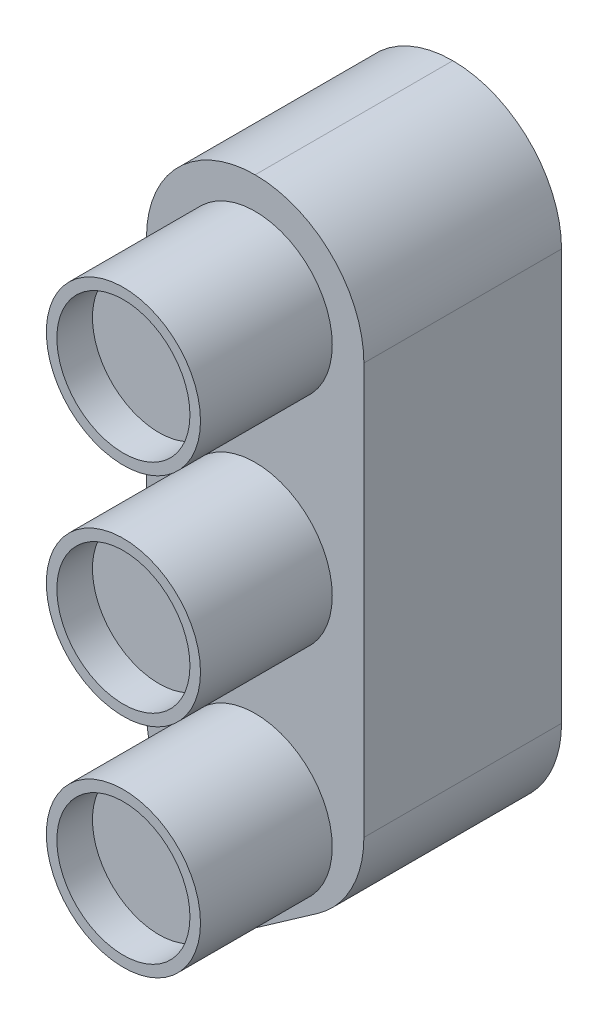
from build123d import *
from OCP.BRepFilletAPI import BRepFilletAPI_MakeChamfer

# Parameters (mm, degrees)
SKETCH1_W                       = 16.5
SKETCH1_H                       = 49.5
BOSS_EXTRUDE1_DEPTH             = 25
SKETCH2_R                       = 5.85
SKETCH2_R_2                     = 5.05
CUT_EXTRUDE1_DEPTH              = 10
FILLET5_R                       = 8.25
CHAMFER1_SIZE                   = 5.77671219
CHAMFER1_SIZE_2                 = 8.25
FILLET6_R                       = 8.25
SKETCH4_R                       = 5.1
BOSS_EXTRUDE2_DEPTH             = 7.3
SCHNITT_LINEAR_AUSTRAGEN1_DEPTH = 9


with BuildPart() as part:
    # Sketch1 → Boss-Extrude1 (new body)
    with BuildSketch(Plane.XY):
        with Locations((-90.75, 140.25)):
            Rectangle(SKETCH1_W, SKETCH1_H)
    extrude(amount=BOSS_EXTRUDE1_DEPTH)

    # Sketch2 → Cut-Extrude1 (cut)
    # profile 1 of 8: a face of its own
    with BuildSketch(Plane.XY.offset(25)):
        with BuildLine():
            ThreePointArc((-96.6, 140.25), (-90.75, 146.1), (-84.9, 140.25))
            Line((-84.9, 140.25), (-82.5, 140.25))
            Line((-82.5, 140.25), (-82.5, 165))
            Line((-82.5, 165), (-99, 165))
            Line((-99, 165), (-99, 140.25))
            Line((-99, 140.25), (-96.6, 140.25))
        make_face()
        with Locations((-90.75, 156.75)):
            Circle(SKETCH2_R, mode=Mode.SUBTRACT)
    # profile 2 of 8: a face of its own
    with BuildSketch(Plane.XY.offset(25)):
        with BuildLine():
            Line((-82.5, 140.25), (-84.9, 140.25))
            ThreePointArc((-84.9, 140.25), (-90.75, 134.4), (-96.6, 140.25))
            Line((-96.6, 140.25), (-99, 140.25))
            Line((-99, 140.25), (-99, 115.5))
            Line((-99, 115.5), (-82.5, 115.5))
            Line((-82.5, 115.5), (-82.5, 140.25))
        make_face()
        with Locations((-90.75, 123.75)):
            Circle(SKETCH2_R, mode=Mode.SUBTRACT)
    # profile 3 of 8: a face of its own
    with BuildSketch(Plane.XY.offset(25)):
        with BuildLine():
            ThreePointArc((-95.8, 140.25), (-90.75, 135.2), (-85.7, 140.25))
            Line((-85.7, 140.25), (-95.8, 140.25))
        make_face()
    # profile 4 of 8: a face of its own
    with BuildSketch(Plane.XY.offset(25)):
        with BuildLine():
            Line((-95.8, 140.25), (-85.7, 140.25))
            ThreePointArc((-85.7, 140.25), (-90.75, 145.3), (-95.8, 140.25))
        make_face()
    # profile 5 of 8: a face of its own
    with BuildSketch(Plane.XY.offset(25)):
        with BuildLine():
            ThreePointArc((-95.8, 140.25), (-90.75, 135.2), (-85.7, 140.25))
            Line((-85.7, 140.25), (-95.8, 140.25))
        make_face()
    # profile 6 of 8: a face of its own
    with BuildSketch(Plane.XY.offset(25)):
        with BuildLine():
            Line((-95.8, 140.25), (-85.7, 140.25))
            ThreePointArc((-85.7, 140.25), (-90.75, 145.3), (-95.8, 140.25))
        make_face()
    # profile 7 of 8: a face of its own
    with BuildSketch(Plane.XY.offset(25)):
        with Locations((-90.75, 123.75)):
            Circle(SKETCH2_R_2)
    # profile 8 of 8: a face of its own
    with BuildSketch(Plane.XY.offset(25)):
        with Locations((-90.75, 156.75)):
            Circle(SKETCH2_R_2)
    extrude(amount=-CUT_EXTRUDE1_DEPTH, mode=Mode.SUBTRACT)

    # Fillet5
    fillet5_edges = [part.edges().sort_by_distance(p)[0] for p in [
        (-82.5, 165, 7.5),
        (-99, 165, 7.5),
    ]]
    fillet(fillet5_edges, radius=FILLET5_R - 0.0001)  # a hair under: the kernel refuses the full size

    # Chamfer1
    chamfer1_edges_1 = [part.edges().sort_by_distance(p)[0] for p in [
        (-99, 115.5, 7.5),
    ]]
    chamfer1_side_1 = [part.faces().sort_by_distance(p)[0] for p in [
        (-99, 115.615534244, 7.5),
    ]]
    chamfer1_edges_2 = [part.edges().sort_by_distance(p)[0] for p in [
        (-82.5, 115.5, 7.5),
    ]]
    chamfer1_side_2 = [part.faces().sort_by_distance(p)[0] for p in [
        (-82.5, 115.615534244, 7.5),
    ]]
    chamfer1 = BRepFilletAPI_MakeChamfer(part.part.solid().wrapped)
    for e in chamfer1_edges_1:
        chamfer1.Add(CHAMFER1_SIZE - 0.0001, CHAMFER1_SIZE_2 - 0.0001, e.wrapped, chamfer1_side_1[0].wrapped)
    for e in chamfer1_edges_2:
        chamfer1.Add(CHAMFER1_SIZE - 0.0001, CHAMFER1_SIZE_2 - 0.0001, e.wrapped, chamfer1_side_2[0].wrapped)
    add(Compound.cast(chamfer1.Shape()), mode=Mode.REPLACE)  # a hair under: the kernel refuses the full size

    # Fillet6
    fillet6_edges = [part.edges().sort_by_distance(p)[0] for p in [
        (-99, 121.27661219, 7.5),
        (-82.5, 121.27661219, 7.5),
    ]]
    fillet(fillet6_edges, radius=FILLET6_R)

    # Sketch4 → Boss-Extrude2 (add)
    with BuildSketch(Plane.XY.offset(15)):
        with Locations((-90.75, 156.75)):
            Circle(SKETCH4_R)
        with Locations((-90.75, 140.25)):
            Circle(SKETCH4_R)
        with Locations((-90.75, 123.75)):
            Circle(SKETCH4_R)
    extrude(amount=BOSS_EXTRUDE2_DEPTH)

    # Skizze2 → Schnitt-Linear austragen1 (cut)
    with BuildSketch(Plane(origin=(0, 0, 0), x_dir=(-1, 0, 0), z_dir=(0, 0, -1))):
        with BuildLine():
            Line((84.5, 156.75), (84.5, 125.571390357))
            ThreePointArc((84.5, 125.571390357), (85.206182293, 122.685461525), (87.165147273, 120.45169008))
            Line((87.165147273, 120.45169008), (90.75, 117.941549178))
            Line((90.75, 117.941549178), (94.334852727, 120.45169008))
            ThreePointArc((94.334852727, 120.45169008), (96.293817707, 122.685461525), (97, 125.571390357))
            Line((97, 125.571390357), (97, 156.75))
            ThreePointArc((97, 156.75), (95.169417382, 161.169417382), (90.75, 163))
            ThreePointArc((90.75, 163), (86.330582618, 161.169417382), (84.5, 156.75))
        make_face()
    extrude(amount=-SCHNITT_LINEAR_AUSTRAGEN1_DEPTH, mode=Mode.SUBTRACT)


solid = part.part
